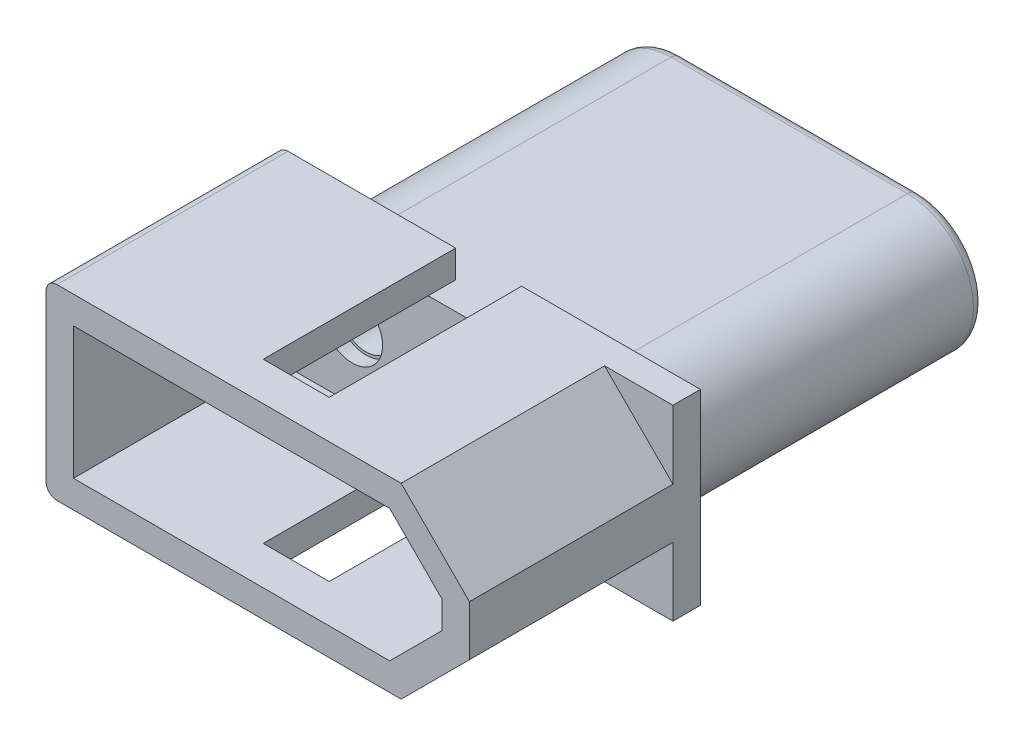
from build123d import *

# Parameters (mm, degrees)
BOSS_EXTRUDE1_DEPTH = 10.668
SKETCH2_R           = 1.27
BOSS_EXTRUDE2_DEPTH = 15.6591
BOSS_EXTRUDE3_START = -1.27
BOSS_EXTRUDE3_DEPTH = 1.27
SKETCH4_R           = 1.397
CUT_EXTRUDE1_DEPTH  = 0.635
CUT_EXTRUDE2_START  = -0.635
SKETCH5_R           = 1.397
CUT_EXTRUDE2_DEPTH  = 0.635
SKETCH6_W           = 3.048
SKETCH6_H           = 1.27
CUT_EXTRUDE3_DEPTH  = 8.89
FILLET1_R           = 0.508


# Read off the part's stored shape, not the designer's step: Boss-Extrude3
with BuildPart() as part:
    # Sketch1 → Boss-Extrude1 (new body)
    with BuildSketch(Plane.XY):
        with BuildLine():
            Line((6.622051224, 4.318), (-9.271, 4.318))
            ThreePointArc((-9.271, 4.318), (-9.630210245, 4.169210245), (-9.779, 3.81))
            Line((-9.779, 3.81), (-9.779, -3.81))
            ThreePointArc((-9.779, -3.81), (-9.630210245, -4.169210245), (-9.271, -4.318))
            Line((-9.271, -4.318), (6.622051224, -4.318))
            Line((6.622051224, -4.318), (9.779, -1.161051224))
            Line((9.779, -1.161051224), (9.779, 1.161051224))
            Line((9.779, 1.161051224), (6.622051224, 4.318))
        make_face()
        Polygon((8.509, -0.635), (8.509, 0.635), (6.096, 3.048), (-8.509, 3.048), (-8.509, -3.048), (6.096, -3.048), align=None, mode=Mode.SUBTRACT)
    extrude(amount=-BOSS_EXTRUDE1_DEPTH)



with BuildPart() as body_2:
    # Sketch2 → Boss-Extrude2 (new body)
    with BuildSketch(Plane.XY.offset(-25.0571)):
        with BuildLine():
            Line((-5.461, 3.048), (5.461, 3.048))
            ThreePointArc((5.461, 3.048), (8.509, 0), (5.461, -3.048))
            Line((5.461, -3.048), (-5.461, -3.048))
            ThreePointArc((-5.461, -3.048), (-8.509, 0), (-5.461, 3.048))
        make_face()
        with Locations((-5.0292, 0)):
            Circle(SKETCH2_R, mode=Mode.SUBTRACT)
        with Locations((5.0292, 0)):
            Circle(SKETCH2_R, mode=Mode.SUBTRACT)
        Circle(SKETCH2_R, mode=Mode.SUBTRACT)
    extrude(amount=BOSS_EXTRUDE2_DEPTH)


with BuildPart() as part_1:
    add(part.part)

    add(body_2.part)  # Boss-Extrude3 merges body 2
    # Boss-Extrude3 outline → Boss-Extrude3 (add)
    with BuildSketch(Plane.XY.offset(-9.398).offset(BOSS_EXTRUDE3_START)):
        Polygon((6.622051224, -4.318), (9.779, -4.318), (9.779, -1.161051224), align=None)
        Polygon((6.622051224, 4.318), (9.779, 1.161051224), (9.779, 4.318), align=None)
        with BuildLine():
            Line((5.461, -3.048), (6.096, -3.048))
            Line((6.096, -3.048), (6.182665302, -2.961334698))
            ThreePointArc((6.182665302, -2.961334698), (5.824425262, -3.026256116), (5.461, -3.048))
        make_face()
        with BuildLine():
            ThreePointArc((8.509, 0), (8.487256116, -0.363425262), (8.422334698, -0.721665302))
            Line((8.422334698, -0.721665302), (8.509, -0.635))
            Line((8.509, -0.635), (8.509, 0))
        make_face()
        with BuildLine():
            Line((-8.509, -3.048), (-5.461, -3.048))
            ThreePointArc((-5.461, -3.048), (-7.616261469, -2.155261469), (-8.509, 0))
            Line((-8.509, 0), (-8.509, -3.048))
        make_face()
        with BuildLine():
            ThreePointArc((8.422334698, 0.721665302), (8.487256116, 0.363425262), (8.509, 0))
            Line((8.509, 0), (8.509, 0.635))
            Line((8.509, 0.635), (8.422334698, 0.721665302))
        make_face()
        with BuildLine():
            Line((-8.509, 3.048), (-8.509, 0))
            ThreePointArc((-8.509, 0), (-7.616261469, 2.155261469), (-5.461, 3.048))
            Line((-5.461, 3.048), (-8.509, 3.048))
        make_face()
        with BuildLine():
            ThreePointArc((5.461, 3.048), (5.824425262, 3.026256116), (6.182665302, 2.961334698))
            Line((6.182665302, 2.961334698), (6.096, 3.048))
            Line((6.096, 3.048), (5.461, 3.048))
        make_face()
    extrude(amount=BOSS_EXTRUDE3_DEPTH)

    # Sketch4 → Cut-Extrude1 (cut)
    with BuildSketch(Plane(origin=(0, 0, -25.0571), x_dir=(-1, 0, 0), z_dir=(0, 0, -1))):
        with Locations((-5.0292, 0)):
            Circle(SKETCH4_R)
        with Locations((5.0292, 0)):
            Circle(SKETCH4_R)
        Circle(SKETCH4_R)
    extrude(amount=-CUT_EXTRUDE1_DEPTH, mode=Mode.SUBTRACT)

    # Sketch5 → Cut-Extrude2 (cut)
    with BuildSketch(Plane.XY.offset(-9.398).offset(CUT_EXTRUDE2_START)):
        with Locations(Location((0, 0, 0), (0, 0, 180))):
            Circle(SKETCH5_R)
        with Locations(Location((-5.0292, 0, 0), (0, 0, 180))):
            Circle(SKETCH5_R)
        with Locations(Location((5.0292, 0, 0), (0, 0, 180))):
            Circle(SKETCH5_R)
    extrude(amount=CUT_EXTRUDE2_DEPTH, mode=Mode.SUBTRACT)

    # Sketch6 → Cut-Extrude3 (cut)
    with BuildSketch(Plane(origin=(0, 0, -10.668), x_dir=(-1, 0, 0), z_dir=(0, 0, -1))):
        with Locations((0, 3.683)):
            Rectangle(SKETCH6_W, SKETCH6_H)
        with Locations((0, -3.683)):
            Rectangle(SKETCH6_W, SKETCH6_H)
    extrude(amount=-CUT_EXTRUDE3_DEPTH, mode=Mode.SUBTRACT)

    # Fillet1
    fillet1_edges = [part_1.edges().sort_by_distance(p)[0] for p in [
        (-8.509, 0, -25.0571),
        (0, 3.048, -25.0571),
        (0, -3.048, -25.0571),
        (8.509, 0, -25.0571),
    ]]
    fillet(fillet1_edges, radius=FILLET1_R)


solid = part_1.part
